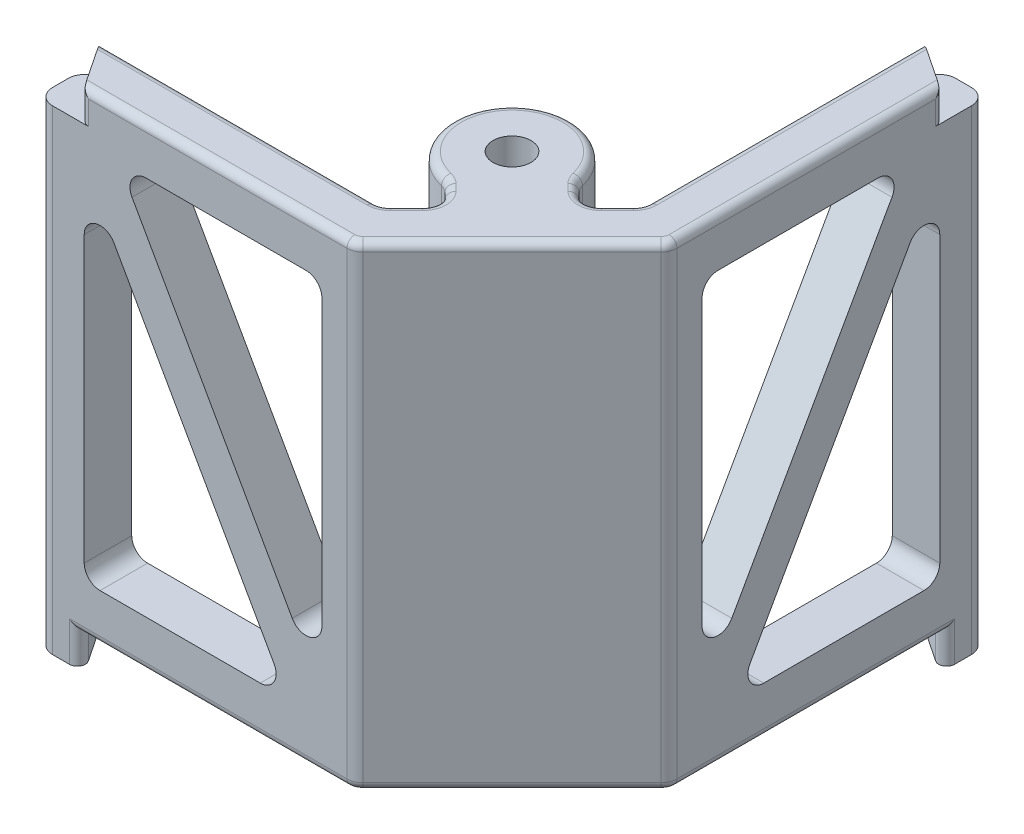
from build123d import *

# Parameters (mm, degrees)
SKETCH1_R           = 1.2000000000000097
BOSS_EXTRUDE1_DEPTH = 30
BOSS_EXTRUDE3_START = 2
BOSS_EXTRUDE3_DEPTH = 2
CUT_EXTRUDE2_START  = -2
CUT_EXTRUDE2_DEPTH  = 2
CUT_EXTRUDE1_DEPTH  = 3
FILLET1_R           = 1
FILLET2_R           = 0.5


with BuildPart() as part:
    # Sketch1 → Boss-Extrude1 (new body)
    with BuildSketch(Plane(origin=(0, 0, 0), x_dir=(1, 0, 0), z_dir=(0, 1, 0))):
        with BuildLine():
            Line((10, 0), (10.000000000000002, 18.999999999999996))
            ThreePointArc((10.000000000000002, 18.999999999999996), (9.70710678118655, 19.707106781186543), (9.000000000000002, 19.999999999999996))
            Line((9.000000000000002, 19.999999999999996), (8, 19.999999999999996))
            ThreePointArc((8, 19.999999999999996), (7.292893218813452, 19.707106781186543), (7.000000000000001, 18.999999999999996))
            Line((7.000000000000001, 18.999999999999996), (7.000000000000003, 1.242640687119288))
            Line((7.000000000000003, 1.242640687119288), (5.000000000000001, -0.757359312880715))
            Line((5.000000000000001, -0.757359312880715), (3.6526596266709936, 0.5899810604482899))
            ThreePointArc((3.6526596266709936, 0.5899810604482899), (-2.6162950903902638, 2.6162950903903), (-0.5899810604482886, -3.652659626670993))
            Line((-0.5899810604482886, -3.652659626670993), (0.7573593128807152, -4.999999999999999))
            Line((0.7573593128807152, -4.999999999999999), (-1.2426406871192812, -7))
            Line((-1.2426406871192812, -7), (-19.000000000000004, -7))
            ThreePointArc((-19.000000000000004, -7), (-19.70710678118655, -7.292893218813452), (-20.000000000000004, -8))
            Line((-20.000000000000004, -8), (-20.000000000000004, -9.000000000000002))
            ThreePointArc((-20.000000000000004, -9.000000000000002), (-19.70710678118655, -9.70710678118655), (-19.000000000000004, -10.000000000000002))
            Line((-19.000000000000004, -10.000000000000002), (0, -10))
            Line((0, -10), (10, 0))
        make_face()
        with Locations(Location((-1.735e-14, 0, 0), (0, 0, 270))):
            Circle(SKETCH1_R, mode=Mode.SUBTRACT)
    extrude(amount=BOSS_EXTRUDE1_DEPTH)

    # Sketch5 → Boss-Extrude3 (add)
    with BuildSketch(Plane.XZ.offset(BOSS_EXTRUDE3_START)):
        with BuildLine():
            Line((-17.000000000000004, 10), (-19.000000000000004, 6.999999999999999))
            ThreePointArc((-19.000000000000004, 6.999999999999999), (-19.70710678118655, 7.292893218813452), (-20.000000000000004, 8))
            Line((-20.000000000000004, 8), (-20.000000000000004, 9.000000000000002))
            ThreePointArc((-20.000000000000004, 9.000000000000002), (-19.70710678118655, 9.70710678118655), (-19.000000000000004, 10.000000000000002))
            Line((-19.000000000000004, 10.000000000000002), (-17.000000000000004, 10))
        make_face()
        with BuildLine():
            Line((8.000000000000004, -20.000000000000007), (8.999999999999998, -20))
            ThreePointArc((8.999999999999998, -20), (9.707106781186546, -19.707106781186546), (9.999999999999998, -19))
            Line((9.999999999999998, -19), (10.000000000000005, -17))
            Line((10.000000000000005, -17), (6.999999999999999, -19.000000000000004))
            ThreePointArc((6.999999999999999, -19.000000000000004), (7.292893218813448, -19.707106781186557), (8.000000000000004, -20.000000000000007))
        make_face()
    extrude(amount=-BOSS_EXTRUDE3_DEPTH)

    # Sketch6 → Cut-Extrude2 (cut)
    with BuildSketch(Plane(origin=(0, 30, 0), x_dir=(1, 0, 0), z_dir=(0, 1, 0)).offset(CUT_EXTRUDE2_START)):
        with BuildLine():
            Line((9.999999999999998, 19), (10.000000000000005, 17))
            Line((10.000000000000005, 17), (6.999999999999999, 19.000000000000004))
            ThreePointArc((6.999999999999999, 19.000000000000004), (7.29289321881345, 19.707106781186553), (8.000000000000004, 20.000000000000004))
            Line((8.000000000000004, 20.000000000000004), (8.999999999999998, 20))
            ThreePointArc((8.999999999999998, 20), (9.707106781186546, 19.707106781186546), (9.999999999999998, 19))
        make_face()
        with BuildLine():
            Line((-17.000000000000004, -10), (-19.000000000000004, -10.000000000000002))
            ThreePointArc((-19.000000000000004, -10.000000000000002), (-19.70710678118655, -9.70710678118655), (-20.000000000000004, -9.000000000000002))
            Line((-20.000000000000004, -9.000000000000002), (-20.000000000000004, -8))
            ThreePointArc((-20.000000000000004, -8), (-19.707106781186553, -7.292893218813452), (-19.000000000000004, -6.999999999999999))
            Line((-19.000000000000004, -6.999999999999999), (-17.000000000000004, -10))
        make_face()
    extrude(amount=CUT_EXTRUDE2_DEPTH, mode=Mode.SUBTRACT)

    # Sketch2 → Cut-Extrude1 (cut)
    with BuildSketch(Plane.XY.offset(10)):
        with BuildLine():
            Line((-13.11093310460082, 27), (-3.000000000000007, 27))
            ThreePointArc((-3.000000000000007, 27), (-2.2928932188134525, 26.707106781186546), (-2, 25.999999999999993))
            Line((-2, 25.999999999999993), (-2, 8.041025142960907))
            ThreePointArc((-2, 8.041025142960907), (-2.7464143876457783, 7.07371219607813), (-3.8713886744138954, 7.550431851014056))
            Line((-3.8713886744138954, 7.550431851014056), (-13.982321779014695, 25.50940670805314))
            ThreePointArc((-13.982321779014695, 25.50940670805314), (-13.974238754978163, 26.5046814381633), (-13.11093310460082, 27))
        make_face()
        with BuildLine():
            Line((-17, 21.95897485703909), (-17, 4.000000000000007))
            ThreePointArc((-17, 4.000000000000007), (-16.707106781186546, 3.2928932188134525), (-15.999999999999993, 3))
            Line((-15.999999999999993, 3), (-5.889066895399184, 2.9999999999999996))
            ThreePointArc((-5.889066895399184, 2.9999999999999996), (-5.025761245021842, 3.495318561836698), (-5.0176782209853075, 4.490593291946855))
            Line((-5.0176782209853075, 4.490593291946855), (-15.128611325586105, 22.449568148985946))
            ThreePointArc((-15.128611325586105, 22.449568148985946), (-16.253585612354225, 22.92628780392187), (-17, 21.95897485703909))
        make_face()
    cut_extrude1 = extrude(amount=-CUT_EXTRUDE1_DEPTH, mode=Mode.SUBTRACT)

    # Mirror6: Cut-Extrude1 across plane
    add(cut_extrude1.mirror(Plane(origin=(0, 0, 0), x_dir=(0.7071067811865478, 0, 0.7071067811865472), z_dir=(-0.7071067811865475, 0, 0.7071067811865477))), mode=Mode.SUBTRACT)

    # Fillet1
    fillet1_edges = [part.edges().sort_by_distance(p)[0] for p in [
        (0, 15, 10),
        (-1.2426406871192812, 15, 7),
        (0.7573593128807152, 15, 4.999999999999999),
        (-0.589981060448288, 15, 3.6526596266709936),
        (3.652659626670993, 15, -0.5899810604482898),
        (5.000000000000001, 15, 0.757359312880715),
        (7.000000000000003, 15, -1.242640687119288),
        (10, 15, 0),
    ]]
    fillet(fillet1_edges, radius=FILLET1_R)

    # Fillet2
    # the kernel refuses this fillet: 0.5 mm, written as the material it takes off along each edge
    with BuildSketch(Plane(origin=(-17.000000000000004, 28, 10), x_dir=(1, 0, 6.64e-15), z_dir=(0, 1, 0))) as fillet2_piece_1:
        with BuildLine():
            CenterArc((FILLET2_R * 0.535183758488, FILLET2_R), FILLET2_R, 213.69006752597994, 56.30993247402046)
            Line((-FILLET2_R * 0.29686653585, FILLET2_R * 0.445299803775), (0, 0))
            Line((0, 0), (FILLET2_R * 0.535183758488, 0))
        make_face()
    extrude(amount=2.6689796981099967, mode=Mode.SUBTRACT)
    with BuildSketch(Plane(origin=(-3.719e-14, 0, -3.741e-14), x_dir=(0.9730680768952584, 0, -0.2305179336350284), z_dir=(0.2305179336350284, 0, 0.9730680768952584))) as fillet2_piece_2:
        with BuildLine():
            CenterArc((3.7000000000000264 - FILLET2_R, FILLET2_R), FILLET2_R, 270, 90)
            Line((3.7000000000000264, FILLET2_R), (3.7000000000000264, 0))
            Line((3.7000000000000264, 0), (3.7000000000000264 - FILLET2_R, 0))
        make_face()
    revolve(axis=Axis((-3.719e-14, 0, -3.741e-14), (0, 1, 0)), revolution_arc=243.34486685283426, mode=Mode.SUBTRACT)
    with BuildSketch(Plane(origin=(-3.719e-14, 30, -3.741e-14), x_dir=(0.9730680768952584, 0, -0.2305179336350284), z_dir=(0.2305179336350284, 0, 0.9730680768952584))) as fillet2_piece_3:
        with BuildLine():
            CenterArc((3.7000000000000264 - FILLET2_R, -FILLET2_R), FILLET2_R, 0, 90)
            Line((3.7000000000000264, -FILLET2_R), (3.7000000000000264, 0))
            Line((3.7000000000000264, 0), (3.7000000000000264 - FILLET2_R, 0))
        make_face()
    revolve(axis=Axis((-3.719e-14, 30, -3.741e-14), (0, 1, 0)), revolution_arc=243.34486685283426, mode=Mode.SUBTRACT)
    with BuildSketch(Plane(origin=(4.292893218813453, 0, 0.05025253169416832), x_dir=(-0.707106781186547, 0, 0.7071067811865481), z_dir=(-0.7071067811865481, 0, -0.707106781186547))) as fillet2_piece_4:
        with BuildLine():
            CenterArc((FILLET2_R, FILLET2_R), FILLET2_R, 180, 90)
            Line((2e-16, FILLET2_R), (0, 0))
            Line((0, 0), (FILLET2_R, 0))
        make_face()
    extrude(amount=0.6032752760148653, mode=Mode.SUBTRACT)
    with BuildSketch(Plane(origin=(4.292893218813453, 30, 0.05025253169416832), x_dir=(-0.707106781186547, 0, 0.7071067811865481), z_dir=(-0.7071067811865481, 0, -0.707106781186547))) as fillet2_piece_5:
        with BuildLine():
            CenterArc((FILLET2_R, -FILLET2_R), FILLET2_R, 90, 90)
            Line((2e-16, -FILLET2_R), (0, 0))
            Line((0, 0), (FILLET2_R, 0))
        make_face()
    extrude(amount=0.6032752760148653, mode=Mode.SUBTRACT)
    with BuildSketch(Plane(origin=(7.000000000000001, 0, -20.249999999999996), x_dir=(1, 0, -1e-16), z_dir=(1e-16, 0, 1))) as fillet2_piece_6_section:
        with BuildLine():
            CenterArc((FILLET2_R, FILLET2_R), FILLET2_R, 180, 90)
            Line((0, FILLET2_R), (0, 0))
            Line((0, 0), (FILLET2_R, 0))
        make_face()
    fillet2_piece_6 = extrude(amount=18.593145750507617, mode=Mode.PRIVATE)
    fillet2_piece_6 = split(fillet2_piece_6, bisect_by=Plane(origin=(11.097667376245742, 0.11346256773380281, -16.26822174916951), z_dir=(-0.554700196225229, 0, 0.8320502943378438)), keep=Keep.TOP, mode=Mode.PRIVATE)
    add(fillet2_piece_6, mode=Mode.SUBTRACT)
    with BuildSketch(Plane(origin=(-1.656854249492377, 0, 7), x_dir=(0, 0, 1), z_dir=(-1, 0, 0))) as fillet2_piece_7_section:
        with BuildLine():
            CenterArc((FILLET2_R, FILLET2_R), FILLET2_R, 180, 90)
            Line((0, FILLET2_R), (0, 0))
            Line((0, 0), (FILLET2_R, 0))
        make_face()
    fillet2_piece_7 = extrude(amount=18.593145750507627, mode=Mode.PRIVATE)
    fillet2_piece_7 = split(fillet2_piece_7, bisect_by=Plane(origin=(-16.268221749169484, 0.11346256773380281, 11.097667376245777), z_dir=(0.8320502943378437, 0, -0.554700196225229)), keep=Keep.TOP, mode=Mode.PRIVATE)
    add(fillet2_piece_7, mode=Mode.SUBTRACT)
    with BuildSketch(Plane(origin=(-1.656854249492377, 30, 7), x_dir=(0, 0, 1), z_dir=(-1, 0, 0))) as fillet2_piece_8:
        with BuildLine():
            CenterArc((FILLET2_R, -FILLET2_R), FILLET2_R, 90, 90)
            Line((0, -FILLET2_R), (0, 0))
            Line((0, 0), (FILLET2_R, 0))
        make_face()
    extrude(amount=18.593145750507627, mode=Mode.SUBTRACT)
    with BuildSketch(Plane(origin=(0.05025253169416988, 0, 5.707106781186546), x_dir=(0.7071067811865483, 0, 0.7071067811865469), z_dir=(-0.7071067811865468, 0, 0.7071067811865483))) as fillet2_piece_9:
        with BuildLine():
            CenterArc((FILLET2_R, FILLET2_R), FILLET2_R, 180, 90)
            Line((-8e-17, FILLET2_R), (0, 0))
            Line((0, 0), (FILLET2_R, 0))
        make_face()
    extrude(amount=1.414213562373095, mode=Mode.SUBTRACT)
    with BuildSketch(Plane(origin=(0.05025253169416988, 30, 5.707106781186546), x_dir=(0.7071067811865483, 0, 0.7071067811865469), z_dir=(-0.7071067811865468, 0, 0.7071067811865483))) as fillet2_piece_10:
        with BuildLine():
            CenterArc((FILLET2_R, -FILLET2_R), FILLET2_R, 90, 90)
            Line((-8e-17, -FILLET2_R), (0, 0))
            Line((0, 0), (FILLET2_R, 0))
        make_face()
    extrude(amount=1.414213562373095, mode=Mode.SUBTRACT)
    with BuildSketch(Plane(origin=(6.70710678118655, 0, -0.9497474683058347), x_dir=(0.7071067811865478, 0, 0.7071067811865474), z_dir=(-0.7071067811865474, 0, 0.7071067811865478))) as fillet2_piece_11:
        with BuildLine():
            CenterArc((FILLET2_R, FILLET2_R), FILLET2_R, 180, 90)
            Line((0, FILLET2_R), (0, 0))
            Line((0, 0), (FILLET2_R, 0))
        make_face()
    extrude(amount=1.4142135623730983, mode=Mode.SUBTRACT)
    with BuildSketch(Plane(origin=(6.70710678118655, 30, -0.9497474683058347), x_dir=(0.7071067811865478, 0, 0.7071067811865474), z_dir=(-0.7071067811865474, 0, 0.7071067811865478))) as fillet2_piece_12:
        with BuildLine():
            CenterArc((FILLET2_R, -FILLET2_R), FILLET2_R, 90, 90)
            Line((0, -FILLET2_R), (0, 0))
            Line((0, 0), (FILLET2_R, 0))
        make_face()
    extrude(amount=1.4142135623730983, mode=Mode.SUBTRACT)
    with BuildSketch(Plane(origin=(-0.37632750689812583, 0, 3.866313180221156), x_dir=(0.7071067811865481, 0, -0.7071067811865469), z_dir=(0.7071067811865469, 0, 0.7071067811865481))) as fillet2_piece_13:
        with BuildLine():
            CenterArc((FILLET2_R, FILLET2_R), FILLET2_R, 180, 90)
            Line((0, FILLET2_R), (0, 0))
            Line((0, 0), (FILLET2_R, 0))
        make_face()
    extrude(amount=0.6032752760148626, mode=Mode.SUBTRACT)
    with BuildSketch(Plane(origin=(-0.37632750689812583, 30, 3.866313180221156), x_dir=(0.7071067811865481, 0, -0.7071067811865469), z_dir=(0.7071067811865469, 0, 0.7071067811865481))) as fillet2_piece_14:
        with BuildLine():
            CenterArc((FILLET2_R, -FILLET2_R), FILLET2_R, 90, 90)
            Line((0, -FILLET2_R), (0, 0))
            Line((0, 0), (FILLET2_R, 0))
        make_face()
    extrude(amount=0.6032752760148626, mode=Mode.SUBTRACT)
    with BuildSketch(Plane(origin=(10, 30, -0.41421356237309676), x_dir=(0, -1, 0), z_dir=(9e-17, 0, -1))) as fillet2_piece_15:
        with BuildLine():
            CenterArc((FILLET2_R, FILLET2_R), FILLET2_R, 180, 90)
            Line((0, FILLET2_R), (0, 0))
            Line((0, 0), (FILLET2_R, 0))
        make_face()
    extrude(amount=17.835786437626904, mode=Mode.SUBTRACT)
    with BuildSketch(Plane(origin=(10, 0, -0.41421356237309676), x_dir=(0, 1, 0), z_dir=(9e-17, 0, -1))) as fillet2_piece_16_section:
        with BuildLine():
            CenterArc((FILLET2_R, -FILLET2_R), FILLET2_R, 90, 90)
            Line((-6e-17, -FILLET2_R), (0, 0))
            Line((0, 0), (FILLET2_R, 0))
        make_face()
    fillet2_piece_16 = extrude(amount=17.835786437626904, mode=Mode.PRIVATE)
    fillet2_piece_16 = split(fillet2_piece_16, bisect_by=Plane(origin=(13.731313237960693, 0.11292290078843248, -14.512457841359542), z_dir=(-0.554700196225229, 0, 0.8320502943378438)), keep=Keep.TOP, mode=Mode.PRIVATE)
    add(fillet2_piece_16, mode=Mode.SUBTRACT)
    with BuildSketch(Plane(origin=(0.292893218813453, 0, 9.707106781186546), x_dir=(-0.7071067811865476, 0, -0.7071067811865476), z_dir=(0.7071067811865476, 0, -0.7071067811865476))) as fillet2_piece_17:
        with BuildLine():
            CenterArc((FILLET2_R, FILLET2_R), FILLET2_R, 180, 90)
            Line((-2.7e-16, FILLET2_R), (0, 0))
            Line((0, 0), (FILLET2_R, 0))
        make_face()
    extrude(amount=13.313708498984763, mode=Mode.SUBTRACT)
    with BuildSketch(Plane(origin=(-0.4142135623730933, 0, 9), x_dir=(0.7071067811865487, 0, 0.7071067811865465), z_dir=(0.7071067811865465, 0, -0.7071067811865487))) as fillet2_piece_18:
        with BuildLine():
            CenterArc((0.9999999999999997 - FILLET2_R, -FILLET2_R), FILLET2_R, 1.272e-14, 90)
            Line((0.9999999999999999, -FILLET2_R), (0.9999999999999997, 0))
            Line((0.9999999999999997, 0), (0.9999999999999997 - FILLET2_R, 0))
        make_face()
    revolve(axis=Axis((-0.4142135623730933, 0, 9), (0, -1, 0)), revolution_arc=45.00000000000005, mode=Mode.SUBTRACT)
    with BuildSketch(Plane(origin=(9.000000000000002, 0, -0.41421356237309687), x_dir=(1, 0, -1.7e-16), z_dir=(-1.7e-16, 0, -1))) as fillet2_piece_19:
        with BuildLine():
            CenterArc((1 - FILLET2_R, -FILLET2_R), FILLET2_R, 6.36e-15, 90)
            Line((1, -FILLET2_R), (1, 0))
            Line((1, 0), (1 - FILLET2_R, 0))
        make_face()
    revolve(axis=Axis((9.000000000000002, 0, -0.41421356237309687), (0, -1, 0)), revolution_arc=44.99999999999995, mode=Mode.SUBTRACT)
    with BuildSketch(Plane(origin=(0.292893218813453, 30, 9.707106781186546), x_dir=(-0.7071067811865476, 0, -0.7071067811865476), z_dir=(0.7071067811865476, 0, -0.7071067811865476))) as fillet2_piece_20:
        with BuildLine():
            CenterArc((FILLET2_R, -FILLET2_R), FILLET2_R, 90, 90)
            Line((-2.7e-16, -FILLET2_R), (0, 0))
            Line((0, 0), (FILLET2_R, 0))
        make_face()
    extrude(amount=13.313708498984763, mode=Mode.SUBTRACT)
    with BuildSketch(Plane(origin=(-0.4142135623730933, 30, 9), x_dir=(0.7071067811865487, 0, 0.7071067811865465), z_dir=(0.7071067811865465, 0, -0.7071067811865487))) as fillet2_piece_21:
        with BuildLine():
            CenterArc((0.9999999999999997 - FILLET2_R, FILLET2_R), FILLET2_R, 270, 90)
            Line((0.9999999999999999, FILLET2_R), (0.9999999999999997, 0))
            Line((0.9999999999999997, 0), (0.9999999999999997 - FILLET2_R, 0))
        make_face()
    revolve(axis=Axis((-0.4142135623730933, 30, 9), (0, -1, 0)), revolution_arc=45.00000000000005, mode=Mode.SUBTRACT)
    with BuildSketch(Plane(origin=(9.000000000000002, 30, -0.41421356237309687), x_dir=(1, 0, -1.7e-16), z_dir=(-1.7e-16, 0, -1))) as fillet2_piece_22:
        with BuildLine():
            CenterArc((1 - FILLET2_R, FILLET2_R), FILLET2_R, 270, 90)
            Line((1 - FILLET2_R, 0), (1, 0))
            Line((1, 0), (1, FILLET2_R))
        make_face()
    revolve(axis=Axis((9.000000000000002, 30, -0.41421356237309687), (0, -1, 0)), revolution_arc=44.99999999999995, mode=Mode.SUBTRACT)
    with BuildSketch(Plane(origin=(4.573419961407703, 0, -1.083434288084677), x_dir=(-0.9730680768952584, 0, 0.23051793363502843), z_dir=(-0.23051793363502843, 0, -0.9730680768952584))) as fillet2_piece_23:
        with BuildLine():
            CenterArc((1.0000000000000002 + FILLET2_R, FILLET2_R), FILLET2_R, 180, 90)
            Line((1.0000000000000007, FILLET2_R), (1.0000000000000002, 0))
            Line((1.0000000000000002, 0), (1.0000000000000002 + FILLET2_R, 0))
        make_face()
    revolve(axis=Axis((4.573419961407703, 0, -1.083434288084677), (0, 1, 0)), revolution_arc=31.67243342641711, mode=Mode.SUBTRACT)
    with BuildSketch(Plane(origin=(4.573419961407703, 30, -1.083434288084677), x_dir=(-0.9730680768952584, 0, 0.23051793363502843), z_dir=(-0.23051793363502843, 0, -0.9730680768952584))) as fillet2_piece_24:
        with BuildLine():
            CenterArc((1.0000000000000002 + FILLET2_R, -FILLET2_R), FILLET2_R, 90, 90)
            Line((1.0000000000000007, -FILLET2_R), (1.0000000000000002, 0))
            Line((1.0000000000000002, 0), (1.0000000000000002 + FILLET2_R, 0))
        make_face()
    revolve(axis=Axis((4.573419961407703, 30, -1.083434288084677), (0, 1, 0)), revolution_arc=31.67243342641711, mode=Mode.SUBTRACT)
    with BuildSketch(Plane(origin=(-1.656854249492377, 0, 6), x_dir=(0, 0, 1), z_dir=(-1, 0, 0))) as fillet2_piece_25:
        with BuildLine():
            CenterArc((1 + FILLET2_R, FILLET2_R), FILLET2_R, 180, 90)
            Line((1, FILLET2_R), (1, 0))
            Line((1, 0), (1 + FILLET2_R, 0))
        make_face()
    revolve(axis=Axis((-1.656854249492377, 0, 6), (0, 1, 0)), revolution_arc=45.00000000000004, mode=Mode.SUBTRACT)
    with BuildSketch(Plane(origin=(-1.656854249492377, 30, 6), x_dir=(0, 0, 1), z_dir=(-1, 0, 0))) as fillet2_piece_26:
        with BuildLine():
            CenterArc((1 + FILLET2_R, -FILLET2_R), FILLET2_R, 90, 90)
            Line((1, -FILLET2_R), (1, 0))
            Line((1, 0), (1 + FILLET2_R, 0))
        make_face()
    revolve(axis=Axis((-1.656854249492377, 30, 6), (0, 1, 0)), revolution_arc=45.00000000000004, mode=Mode.SUBTRACT)
    with BuildSketch(Plane(origin=(4.999999999999999, 0, -0.6568542494923792), x_dir=(-0.707106781186547, 0, 0.707106781186548), z_dir=(-0.707106781186548, 0, -0.707106781186547))) as fillet2_piece_27:
        with BuildLine():
            CenterArc((1 + FILLET2_R, FILLET2_R), FILLET2_R, 180, 90)
            Line((1.0000000000000002, FILLET2_R), (1, 0))
            Line((1, 0), (1 + FILLET2_R, 0))
        make_face()
    revolve(axis=Axis((4.999999999999999, 0, -0.6568542494923792), (0, 1, 0)), revolution_arc=90, mode=Mode.SUBTRACT)
    with BuildSketch(Plane(origin=(4.999999999999999, 30, -0.6568542494923792), x_dir=(-0.707106781186547, 0, 0.707106781186548), z_dir=(-0.707106781186548, 0, -0.707106781186547))) as fillet2_piece_28:
        with BuildLine():
            CenterArc((1 + FILLET2_R, -FILLET2_R), FILLET2_R, 90, 90)
            Line((1.0000000000000002, -FILLET2_R), (1, 0))
            Line((1, 0), (1 + FILLET2_R, 0))
        make_face()
    revolve(axis=Axis((4.999999999999999, 30, -0.6568542494923792), (0, 1, 0)), revolution_arc=90, mode=Mode.SUBTRACT)
    with BuildSketch(Plane(origin=(6.000000000000003, 0, -1.6568542494923808), x_dir=(0.7071067811865478, 0, 0.7071067811865474), z_dir=(-0.7071067811865474, 0, 0.7071067811865478))) as fillet2_piece_29:
        with BuildLine():
            CenterArc((1.0000000000000002 + FILLET2_R, FILLET2_R), FILLET2_R, 180, 90)
            Line((1.0000000000000002, FILLET2_R), (1.0000000000000002, 0))
            Line((1.0000000000000002, 0), (1.0000000000000002 + FILLET2_R, 0))
        make_face()
    revolve(axis=Axis((6.000000000000003, 0, -1.6568542494923808), (0, 1, 0)), revolution_arc=44.99999999999993, mode=Mode.SUBTRACT)
    with BuildSketch(Plane(origin=(6.000000000000003, 30, -1.6568542494923808), x_dir=(0.7071067811865478, 0, 0.7071067811865474), z_dir=(-0.7071067811865474, 0, 0.7071067811865478))) as fillet2_piece_30:
        with BuildLine():
            CenterArc((1.0000000000000002 + FILLET2_R, -FILLET2_R), FILLET2_R, 90, 90)
            Line((1.0000000000000002, -FILLET2_R), (1.0000000000000002, 0))
            Line((1.0000000000000002, 0), (1.0000000000000002 + FILLET2_R, 0))
        make_face()
    revolve(axis=Axis((6.000000000000003, 30, -1.6568542494923808), (0, 1, 0)), revolution_arc=44.99999999999993, mode=Mode.SUBTRACT)
    with BuildSketch(Plane(origin=(-0.6568542494923786, 0, 4.999999999999999), x_dir=(0.7071067811865481, 0, 0.707106781186547), z_dir=(-0.707106781186547, 0, 0.7071067811865481))) as fillet2_piece_31:
        with BuildLine():
            CenterArc((1.0000000000000002 + FILLET2_R, FILLET2_R), FILLET2_R, 180, 90)
            Line((1, FILLET2_R), (1.0000000000000002, 0))
            Line((1.0000000000000002, 0), (1.0000000000000002 + FILLET2_R, 0))
        make_face()
    revolve(axis=Axis((-0.6568542494923786, 0, 4.999999999999999), (0, 1, 0)), revolution_arc=89.99999999999993, mode=Mode.SUBTRACT)
    with BuildSketch(Plane(origin=(-0.6568542494923786, 30, 4.999999999999999), x_dir=(0.7071067811865481, 0, 0.707106781186547), z_dir=(-0.707106781186547, 0, 0.7071067811865481))) as fillet2_piece_32:
        with BuildLine():
            CenterArc((1.0000000000000002 + FILLET2_R, -FILLET2_R), FILLET2_R, 90, 90)
            Line((1, -FILLET2_R), (1.0000000000000002, 0))
            Line((1.0000000000000002, 0), (1.0000000000000002 + FILLET2_R, 0))
        make_face()
    revolve(axis=Axis((-0.6568542494923786, 30, 4.999999999999999), (0, 1, 0)), revolution_arc=89.99999999999993, mode=Mode.SUBTRACT)
    with BuildSketch(Plane(origin=(-1.0834342880846735, 0, 4.573419961407703), x_dir=(0.707106781186548, 0, -0.7071067811865471), z_dir=(0.7071067811865471, 0, 0.707106781186548))) as fillet2_piece_33:
        with BuildLine():
            CenterArc((1 + FILLET2_R, FILLET2_R), FILLET2_R, 180, 90)
            Line((0.9999999999999999, FILLET2_R), (1, 0))
            Line((1, 0), (1 + FILLET2_R, 0))
        make_face()
    revolve(axis=Axis((-1.0834342880846735, 0, 4.573419961407703), (0, 1, 0)), revolution_arc=31.672433426417363, mode=Mode.SUBTRACT)
    with BuildSketch(Plane(origin=(-1.0834342880846735, 30, 4.573419961407703), x_dir=(0.707106781186548, 0, -0.7071067811865471), z_dir=(0.7071067811865471, 0, 0.707106781186548))) as fillet2_piece_34:
        with BuildLine():
            CenterArc((1 + FILLET2_R, -FILLET2_R), FILLET2_R, 90, 90)
            Line((0.9999999999999999, -FILLET2_R), (1, 0))
            Line((1, 0), (1 + FILLET2_R, 0))
        make_face()
    revolve(axis=Axis((-1.0834342880846735, 30, 4.573419961407703), (0, 1, 0)), revolution_arc=31.672433426417363, mode=Mode.SUBTRACT)
    with BuildSketch(Plane(origin=(7.000000000000001, 30, -20.249999999999996), x_dir=(1, 0, -1e-16), z_dir=(1e-16, 0, 1))) as fillet2_piece_35:
        with BuildLine():
            CenterArc((FILLET2_R, -FILLET2_R), FILLET2_R, 90, 90)
            Line((0, -FILLET2_R), (0, 0))
            Line((0, 0), (FILLET2_R, 0))
        make_face()
    extrude(amount=18.593145750507617, mode=Mode.SUBTRACT)
    with BuildSketch(Plane(origin=(-18.250000000000004, 0, 10.000000000000002), x_dir=(-9e-17, 0, -1), z_dir=(1, 0, -9e-17))) as fillet2_piece_36_section:
        with BuildLine():
            CenterArc((FILLET2_R, FILLET2_R), FILLET2_R, 180, 90)
            Line((0, FILLET2_R), (0, 0))
            Line((0, 0), (FILLET2_R, 0))
        make_face()
    fillet2_piece_36 = extrude(amount=17.83578643762691, mode=Mode.PRIVATE)
    fillet2_piece_36 = split(fillet2_piece_36, bisect_by=Plane(origin=(-14.51245784135957, 0.11292290078843337, 13.731313237960652), z_dir=(0.8320502943378437, 0, -0.554700196225229)), keep=Keep.TOP, mode=Mode.PRIVATE)
    add(fillet2_piece_36, mode=Mode.SUBTRACT)
    with BuildSketch(Plane(origin=(-17.000000000000004, -4.3356463647766645, 10.000000000000002), x_dir=(-1, 0, 0), z_dir=(0, 1, 0))) as fillet2_piece_37:
        with BuildLine():
            CenterArc((FILLET2_R * 1.86851709182, -FILLET2_R), FILLET2_R, 90, 123.69006752597997)
            Line((FILLET2_R * 1.03646679748, -FILLET2_R * 1.55470019623), (0, 0))
            Line((0, 0), (FILLET2_R * 1.86851709182, 0))
        make_face()
    extrude(amount=4.3356463647766645, mode=Mode.SUBTRACT)
    with BuildSketch(Plane(origin=(10.000000000000002, -4.3356463647766645, -17.000000000000004), x_dir=(0, 0, -1), z_dir=(0, 1, 0))) as fillet2_piece_38:
        with BuildLine():
            CenterArc((FILLET2_R * 1.86851709182, FILLET2_R), FILLET2_R, 146.30993247402046, 123.69006752597954)
            Line((FILLET2_R * 1.03646679748, FILLET2_R * 1.55470019623), (0, 0))
            Line((0, 0), (FILLET2_R * 1.86851709182, 0))
        make_face()
    extrude(amount=4.3356463647766645, mode=Mode.SUBTRACT)
    with BuildSketch(Plane(origin=(-18.250000000000004, 30, 10.000000000000002), x_dir=(-9e-17, 0, -1), z_dir=(1, 0, -9e-17))) as fillet2_piece_39:
        with BuildLine():
            CenterArc((FILLET2_R, -FILLET2_R), FILLET2_R, 90, 90)
            Line((0, -FILLET2_R), (0, 0))
            Line((0, 0), (FILLET2_R, 0))
        make_face()
    extrude(amount=17.83578643762691, mode=Mode.SUBTRACT)
    with BuildSketch(Plane(origin=(10.000000000000005, 28, -17), x_dir=(-1.328e-14, 0, 1), z_dir=(0, 1, 0))) as fillet2_piece_40:
        with BuildLine():
            CenterArc((FILLET2_R * 0.535183758488, -FILLET2_R), FILLET2_R, 90.00000000000077, 56.30993247401972)
            Line((-FILLET2_R * 0.29686653585, -FILLET2_R * 0.445299803775), (0, 0))
            Line((0, 0), (FILLET2_R * 0.535183758488, 0))
        make_face()
    extrude(amount=2.668979698109993, mode=Mode.SUBTRACT)
    with BuildSketch(Plane(origin=(10, 0, -0.41421356237309676), x_dir=(0, 1, 0), z_dir=(9e-17, 0, -1))) as fillet2_piece_41a_section:
        with BuildLine():
            CenterArc((FILLET2_R, -FILLET2_R), FILLET2_R, 90, 90)
            Line((-6e-17, -FILLET2_R), (0, 0))
            Line((0, 0), (FILLET2_R, 0))
        make_face()
    fillet2_piece_41a = extrude(amount=17.835786437626904, mode=Mode.PRIVATE)
    fillet2_piece_41a = split(fillet2_piece_41a, bisect_by=Plane(origin=(9.621336332371705, 0.11709366800308318, -17.25244244508553), z_dir=(0.554700196225229, 0, -0.8320502943378438)), keep=Keep.TOP, mode=Mode.PRIVATE)
    with BuildSketch(Plane(origin=(10.000000000000002, -4.3356463647766645, -17.000000000000004), x_dir=(0, 0, -1), z_dir=(0, 1, 0))) as fillet2_piece_41b_section:
        with BuildLine():
            CenterArc((FILLET2_R * 1.86851709182, FILLET2_R), FILLET2_R, 146.30993247402046, 123.69006752597954)
            Line((FILLET2_R * 1.03646679748, FILLET2_R * 1.55470019623), (0, 0))
            Line((0, 0), (FILLET2_R * 1.86851709182, 0))
        make_face()
    fillet2_piece_41b = extrude(amount=6.671292729553329, mode=Mode.PRIVATE)
    fillet2_piece_41b = split(fillet2_piece_41b, bisect_by=Plane(origin=(9.80681306214817, 0, -17.360973095292774), z_dir=(0, 1, 0)), keep=Keep.TOP, mode=Mode.PRIVATE)
    fillet2_piece_41 = fillet2_piece_41a & fillet2_piece_41b
    add(fillet2_piece_41, mode=Mode.SUBTRACT)
    with BuildSketch(Plane(origin=(-18.250000000000004, 0, 10.000000000000002), x_dir=(-9e-17, 0, -1), z_dir=(1, 0, -9e-17))) as fillet2_piece_42a_section:
        with BuildLine():
            CenterArc((FILLET2_R, FILLET2_R), FILLET2_R, 180, 90)
            Line((0, FILLET2_R), (0, 0))
            Line((0, 0), (FILLET2_R, 0))
        make_face()
    fillet2_piece_42a = extrude(amount=17.83578643762691, mode=Mode.PRIVATE)
    fillet2_piece_42a = split(fillet2_piece_42a, bisect_by=Plane(origin=(-17.252442445085553, 0.1170936680030703, 9.621336332371675), z_dir=(-0.8320502943378437, 0, 0.554700196225229)), keep=Keep.TOP, mode=Mode.PRIVATE)
    with BuildSketch(Plane(origin=(-17.000000000000004, -4.3356463647766645, 10.000000000000002), x_dir=(-1, 0, 0), z_dir=(0, 1, 0))) as fillet2_piece_42b_section:
        with BuildLine():
            CenterArc((FILLET2_R * 1.86851709182, -FILLET2_R), FILLET2_R, 90, 123.69006752597997)
            Line((FILLET2_R * 1.03646679748, -FILLET2_R * 1.55470019623), (0, 0))
            Line((0, 0), (FILLET2_R * 1.86851709182, 0))
        make_face()
    fillet2_piece_42b = extrude(amount=6.671292729553329, mode=Mode.PRIVATE)
    fillet2_piece_42b = split(fillet2_piece_42b, bisect_by=Plane(origin=(-17.36097309529278, 0, 9.80681306214817), z_dir=(0, 1, 0)), keep=Keep.TOP, mode=Mode.PRIVATE)
    fillet2_piece_42 = fillet2_piece_42a & fillet2_piece_42b
    add(fillet2_piece_42, mode=Mode.SUBTRACT)


solid = part.part
